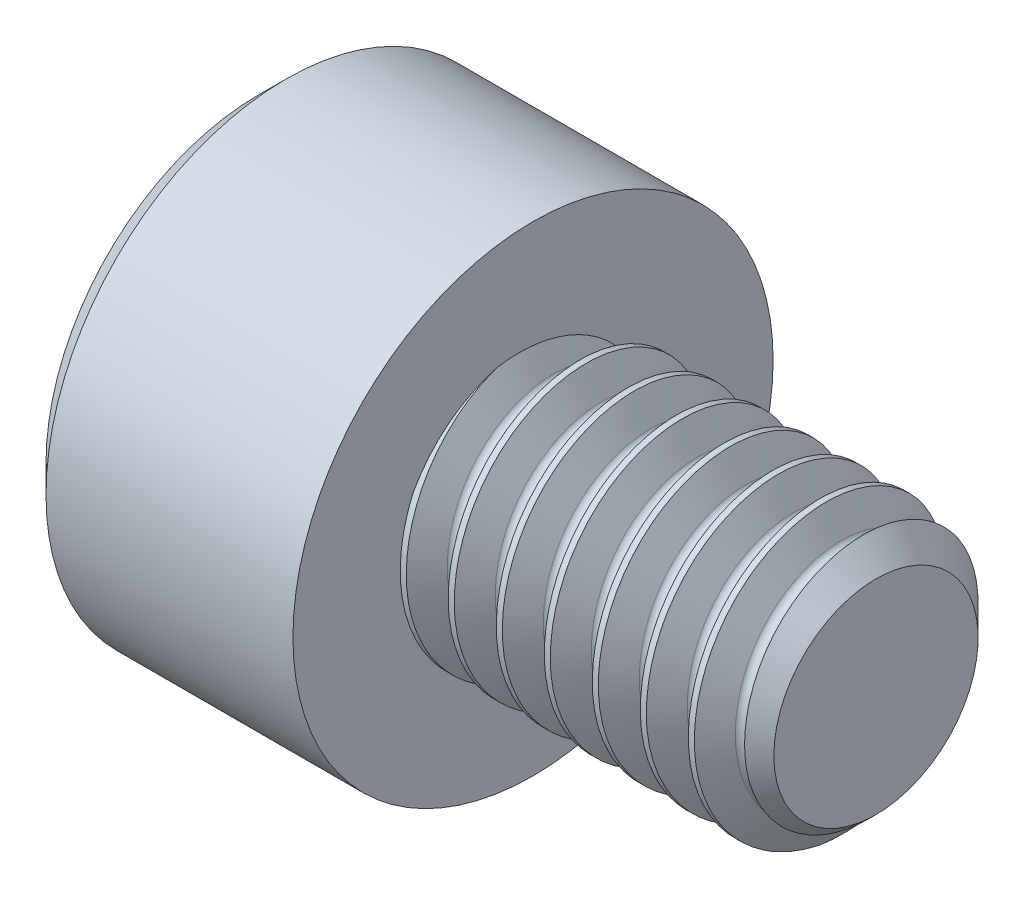
from build123d import *

# Parameters (mm, degrees)
CHAMFER1_SIZE      = 0.5
CHAMFER2_SIZE      = 0.4
CUT_EXTRUDE1_DEPTH = 2
CHAMFER3_SIZE      = 0.3
CUT_SWEEP1_PITCH   = 0.7
CUT_SWEEP1_TO      = 5


with BuildPart() as part:
    # Sketch1 → Revolve1 (revolve)
    with BuildSketch(Plane.XY, mode=Mode.PRIVATE) as revolve1_sk:
        Polygon((0, 0), (0, 3.5), (4, 3.5), (4, 1.989), (9, 1.989), (9, 0), align=None)
    revolve(revolve1_sk.sketch.rotate(Axis((-88.705490849, 0, 0), (1, 0, 0)), 90), axis=Axis((-88.705490849, 0, 0), (1, 0, 0)))

    # Chamfer1
    chamfer1_edges = [part.edges().sort_by_distance(p)[0] for p in [
        (9, 0, -1.989),
    ]]
    chamfer(chamfer1_edges, length=CHAMFER1_SIZE)

    # Chamfer2
    chamfer2_edges = [part.edges().sort_by_distance(p)[0] for p in [
        (0, 0, -3.5),
    ]]
    chamfer(chamfer2_edges, length=CHAMFER2_SIZE)

    # Sketch3 → Cut-Extrude1 (cut)
    with BuildSketch(Plane(origin=(0, 0, 0), x_dir=(0, 0, -1), z_dir=(1, 0, 0))):
        Polygon((-1.732050808, 0), (-0.866025404, -1.5), (0.866025404, -1.5), (1.732050808, 0), (0.866025404, 1.5), (-0.866025404, 1.5), align=None)
    extrude(amount=CUT_EXTRUDE1_DEPTH, mode=Mode.SUBTRACT)

    # Chamfer3
    chamfer3_edges = [part.edges().sort_by_distance(p)[0] for p in [
        (0, 0.75, 1.299038106),
        (0, -0.75, 1.299038106),
        (0, -1.5, 0),
        (0, -0.75, -1.299038106),
        (0, 0.75, -1.299038106),
        (0, 1.5, 0),
    ]]
    chamfer(chamfer3_edges, length=CHAMFER3_SIZE)

    # Cut-Sweep1: arcs per turn and ends read off the stored shape
    # Cut-Sweep1: the profile of Sketch8 screwed along a right-hand helix through 9 turns, 6 arcs to a turn; built about Z, then put on its axis
    cut_sweep1_z = Axis((0, 0, 0), (0, 0, 1))
    cut_sweep1_corners = [(1.61025, 0, -0.087468566), (2.254125, 0, -0.45920997), (2.254125, 0, 0.45920997), (1.61025, 0, 0.087468566), (1.55975, 0, 0)]
    with BuildLine(mode=Mode.PRIVATE) as cut_sweep1_profile:
        Line(cut_sweep1_corners[0], cut_sweep1_corners[1])
        Line(cut_sweep1_corners[1], cut_sweep1_corners[2])
        Line(cut_sweep1_corners[2], cut_sweep1_corners[3])
        ThreePointArc((1.61025, 0, 0.087468566), (1.573281434, 0, 0.0505), (1.55975, 0, 0))
        ThreePointArc((1.55975, 0, 0), (1.573281434, 0, -0.0505), (1.61025, 0, -0.087468566))
    cut_sweep1_cap = Face(cut_sweep1_profile.wire())
    cut_sweep1_arcs = [((1.61025, 0, 0.087468566), (1.55975, 0, 0.058312377), (1.55975, 0, 0), (1, 0.8660254037844394, 1)), ((1.55975, 0, 0), (1.55975, 0, -0.058312377), (1.61025, 0, -0.087468566), (1, 0.8660254037844394, 1))]  # start, shoulder, end, weights
    cut_sweep1_turn_angles = [0, 30, 60, 90, 120, 150, 180, 210, 240, 270, 300, 330, 360]
    cut_sweep1_turn_weights = [1, 0.8660254037844387, 1, 0.8660254037844387, 1, 0.8660254037844387, 1, 0.8660254037844387, 1, 0.8660254037844387, 1, 0.8660254037844387, 1]
    cut_sweep1_turn_rails = [Edge.make_bspline([Vector(p[0], p[1], 0).rotate(cut_sweep1_z, cut_sweep1_turn_angles[k]) / cut_sweep1_turn_weights[k] + Vector(0, 0, p[2] + CUT_SWEEP1_PITCH * cut_sweep1_turn_angles[k] / 360) for k in range(13)], [0, 0, 0, 1, 1, 2, 2, 3, 3, 4, 4, 5, 5, 6, 6, 6], 2, cut_sweep1_turn_weights) for p in cut_sweep1_corners]
    cut_sweep1_turn_sides = [*[Face.make_surface_from_curves(cut_sweep1_turn_rails[p[0]], cut_sweep1_turn_rails[p[1]]) for p in [(0, 1), (1, 2), (2, 3)]], *[Face.make_bezier_surface([[Vector(p[j][0], p[j][1], 0).rotate(cut_sweep1_z, cut_sweep1_turn_angles[2 * i + k]) / cut_sweep1_turn_weights[2 * i + k] + Vector(0, 0, p[j][2] + CUT_SWEEP1_PITCH * cut_sweep1_turn_angles[2 * i + k] / 360) for k in range(3)] for j in range(3)], [[p[3][j] * cut_sweep1_turn_weights[2 * i + k] for k in range(3)] for j in range(3)]) for p in cut_sweep1_arcs for i in range(6)]]
    cut_sweep1_turn = Solid(Shell([*cut_sweep1_turn_sides, cut_sweep1_cap, cut_sweep1_cap.rotate(cut_sweep1_z, 360).moved(Location((0, 0, CUT_SWEEP1_PITCH * 360 / 360)))]))
    cut_sweep1_each = [*[cut_sweep1_turn.moved(Location((0, 0, CUT_SWEEP1_PITCH * i))) for i in range(9)]]
    add(Plane(origin=(9, 0, 0), x_dir=(0, 0, -1), z_dir=(-1, 0, 0)) * split(Compound([cut_sweep1_each[i] for i in range(0, 9, 2)]), bisect_by=Plane.XY.offset(CUT_SWEEP1_TO), keep=Keep.BOTTOM, mode=Mode.PRIVATE), mode=Mode.SUBTRACT)
    add(Plane(origin=(9, 0, 0), x_dir=(0, 0, -1), z_dir=(-1, 0, 0)) * split(Compound([cut_sweep1_each[i] for i in range(1, 9, 2)]), bisect_by=Plane.XY.offset(CUT_SWEEP1_TO), keep=Keep.BOTTOM, mode=Mode.PRIVATE), mode=Mode.SUBTRACT)


solid = part.part
